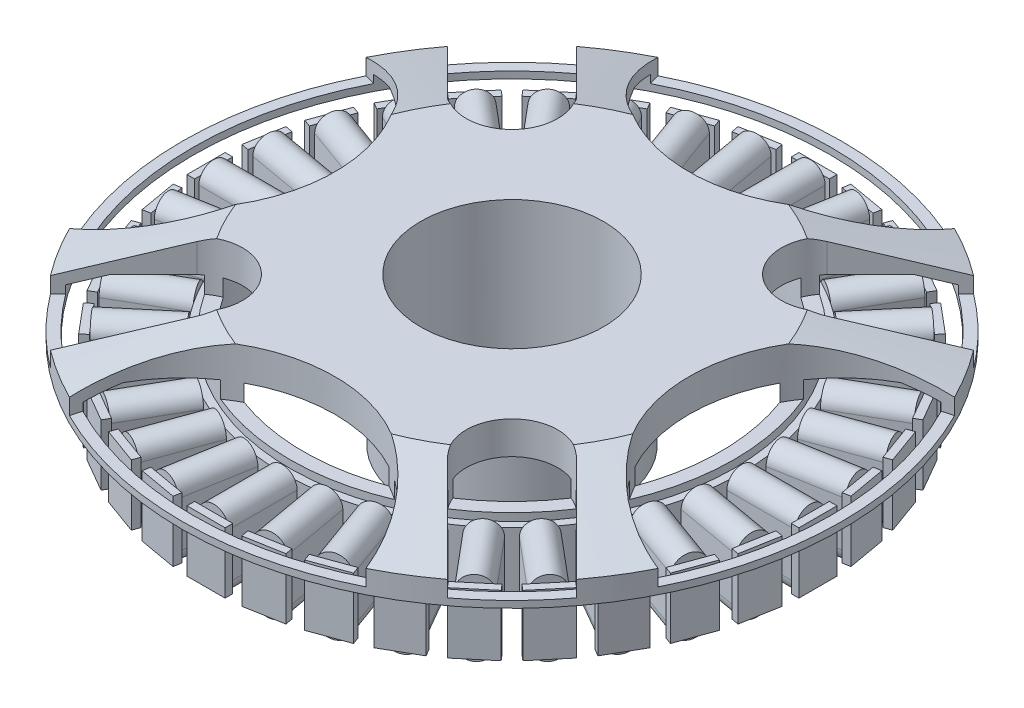
from build123d import *
from build123d.topology import SkipClean

# Parameters (mm, degrees)
SKETCH1_R           = 43.25
SKETCH1_R_2         = 41.85
BOSS_EXTRUDE1_DEPTH = 1.5
SKETCH3_R           = 13.5
BOSS_EXTRUDE2_DEPTH = 15
SKETCH4_R           = 7.5
BOSS_EXTRUDE3_DEPTH = 18
SKETCH5_R           = 6.6
CUT_EXTRUDE1_DEPTH  = 20
SKETCH6_R           = 2.5
CUT_EXTRUDE2_DEPTH  = 72.640875204
SKETCH7_R           = 20
CUT_EXTRUDE3_DEPTH  = 6.5
SKETCH8_R           = 12
CUT_EXTRUDE4_DEPTH  = 72.640875204
SKETCH10_R          = 29.15
SKETCH10_R_2        = 27.35
BOSS_EXTRUDE4_DEPTH = 10
BOSS_EXTRUDE5_START = 2.2
BOSS_EXTRUDE5_DEPTH = 2.2
BOSS_EXTRUDE6_START = -8
BOSS_EXTRUDE6_DEPTH = 8
BOSS_EXTRUDE7_DEPTH = 9
CIRPATTERN1_COUNT   = 36
BOSS_EXTRUDE8_START = -8
SKETCH14_R          = 30.15
SKETCH14_R_2        = 29.15
BOSS_EXTRUDE8_DEPTH = 8
CIRPATTERN2_COUNT   = 36


with BuildPart() as part:
    # Sketch1 → Boss-Extrude1 (new body)
    with BuildSketch(Plane(origin=(0, 0, 0), x_dir=(1, 0, 0), z_dir=(0, 1, 0))):
        with Locations(Location((0, 0, 0), (0, 0, 270))):
            Circle(SKETCH1_R)
        with Locations(Location((0, 0, 0), (0, 0, 270))):
            Circle(SKETCH1_R_2, mode=Mode.SUBTRACT)
    extrude(amount=BOSS_EXTRUDE1_DEPTH)

    # Sketch2 → Revolve1 (revolve)
    with BuildSketch(Plane.XY):
        Polygon((0, 7.4), (-28, 7.4), (-43.25, 3), (-43.25, 1.5), (-41.85, 1.5), (-41.85, 1.946826667), (-37.853206063, 3.1), (0, 3.1), align=None)
    revolve(axis=Axis((0, 7.4, 0), (0, -1, 0)))

    # Sketch3 → Boss-Extrude2 (add)
    with BuildSketch(Plane.XZ.offset(-3.1)):
        Circle(SKETCH3_R)
    extrude(amount=BOSS_EXTRUDE2_DEPTH)

    # Sketch4 → Boss-Extrude3 (add)
    with BuildSketch(Plane.XZ.offset(11.9)):
        Circle(SKETCH4_R)
    extrude(amount=BOSS_EXTRUDE3_DEPTH)

    # Sketch5 → Cut-Extrude1 (cut)
    with BuildSketch(Plane(origin=(0, 7.4, 0), x_dir=(1, 0, 0), z_dir=(0, 1, 0))):
        with Locations(Location((0, 0, 0), (0, 0, 180))):
            Circle(SKETCH5_R)
    extrude(amount=-CUT_EXTRUDE1_DEPTH, mode=Mode.SUBTRACT)

    # Sketch6 → Cut-Extrude2 (cut, through all)
    with BuildSketch(Plane.XZ.offset(29.9)):
        Circle(SKETCH6_R)
    extrude(amount=-CUT_EXTRUDE2_DEPTH, mode=Mode.SUBTRACT)

    # Sketch7 → Cut-Extrude3 (cut)
    with SkipClean():  # the faces are left unmerged after this step: merging them gives an invalid solid
        with BuildSketch(Plane(origin=(0, 7.4, 0), x_dir=(1, 0, 0), z_dir=(0, 1, 0))):
            with Locations((0, 43.25)):
                Circle(SKETCH7_R)
            with Locations((43.25, 0)):
                Circle(SKETCH7_R)
            with Locations((0, -43.25)):
                Circle(SKETCH7_R)
            with Locations((-43.25, 0)):
                Circle(SKETCH7_R)
            with BuildLine():
                Line((-26.339727599, 34.825008973), (-16.440232663, 24.925514037))
                ThreePointArc((-16.440232663, 24.925514037), (-16.440232663, 16.440232663), (-24.925514037, 16.440232663))
                Line((-24.925514037, 16.440232663), (-34.825008973, 26.339727599))
                ThreePointArc((-34.825008973, 26.339727599), (-34.825008973, 34.825008973), (-26.339727599, 34.825008973))
            make_face()
            with BuildLine():
                Line((26.339727599, 34.825008973), (16.440232663, 24.925514037))
                ThreePointArc((16.440232663, 24.925514037), (16.440232663, 16.440232663), (24.925514037, 16.440232663))
                Line((24.925514037, 16.440232663), (34.825008973, 26.339727599))
                ThreePointArc((34.825008973, 26.339727599), (34.825008973, 34.825008973), (26.339727599, 34.825008973))
            make_face()
            with BuildLine():
                Line((34.825008973, -26.339727599), (24.925514037, -16.440232663))
                ThreePointArc((24.925514037, -16.440232663), (16.440232663, -16.440232663), (16.440232663, -24.925514037))
                Line((16.440232663, -24.925514037), (26.339727599, -34.825008973))
                ThreePointArc((26.339727599, -34.825008973), (34.825008973, -34.825008973), (34.825008973, -26.339727599))
            make_face()
            with BuildLine():
                Line((-26.339727599, -34.825008973), (-16.440232663, -24.925514037))
                ThreePointArc((-16.440232663, -24.925514037), (-16.440232663, -16.440232663), (-24.925514037, -16.440232663))
                Line((-24.925514037, -16.440232663), (-34.825008973, -26.339727599))
                ThreePointArc((-34.825008973, -26.339727599), (-34.825008973, -34.825008973), (-26.339727599, -34.825008973))
            make_face()
        extrude(amount=-CUT_EXTRUDE3_DEPTH, mode=Mode.SUBTRACT)

    # Sketch8 → Cut-Extrude4 (cut, through all)
    with SkipClean():  # the faces are left unmerged after this step: merging them gives an invalid solid
        with BuildSketch(Plane(origin=(0, 7.4, 0), x_dir=(1, 0, 0), z_dir=(0, 1, 0))):
            with Locations(Location((0, 0, 0), (0, 0, 180))):
                Circle(SKETCH8_R)
        extrude(amount=-CUT_EXTRUDE4_DEPTH, mode=Mode.SUBTRACT)



with BuildPart() as body_2:
    # Sketch10 → Boss-Extrude4 (new body)
    with BuildSketch(Plane(origin=(0, 0.9, 0), x_dir=(1, 0, 0), z_dir=(0, 1, 0))):
        with Locations(Location((0, 0, 0), (0, 0, 180))):
            Circle(SKETCH10_R)
        with Locations(Location((0, 0, 0), (0, 0, 180))):
            Circle(SKETCH10_R_2, mode=Mode.SUBTRACT)
    extrude(amount=-BOSS_EXTRUDE4_DEPTH)


with BuildPart() as part_1:
    with SkipClean():  # the faces are left unmerged after this step: merging them gives an invalid solid
        add(part.part)

        add(body_2.part)  # Boss-Extrude5 merges body 2
        # Sketch11 → Boss-Extrude5 (add)
        with BuildSketch(Plane(origin=(0, 0.9, 0), x_dir=(1, 0, 0), z_dir=(0, 1, 0)).offset(BOSS_EXTRUDE5_START)):
            with BuildLine():
                ThreePointArc((24.389531526, -15.964750294), (25.707885383, -13.741438395), (26.824104046, -11.410080723))
                ThreePointArc((26.824104046, -11.410080723), (26.209360129, -10.469794305), (25.648381503, -9.496474413))
                ThreePointArc((25.648381503, -9.496474413), (24.394010533, -12.367487624), (22.819521394, -15.076204541))
                ThreePointArc((22.819521394, -15.076204541), (23.638111967, -15.461133724), (24.389531526, -15.964750294))
            make_face()
            with BuildLine():
                ThreePointArc((11.410080723, -26.824104046), (13.741438395, -25.707885383), (15.964750294, -24.389531526))
                ThreePointArc((15.964750294, -24.389531526), (15.461133724, -23.638111967), (15.076204541, -22.819521394))
                ThreePointArc((15.076204541, -22.819521394), (12.367487624, -24.394010533), (9.496474413, -25.648381503))
                ThreePointArc((9.496474413, -25.648381503), (10.469794305, -26.209360129), (11.410080723, -26.824104046))
            make_face()
            with BuildLine():
                ThreePointArc((-15.964750294, -24.389531526), (-13.741438395, -25.707885383), (-11.410080723, -26.824104046))
                ThreePointArc((-11.410080723, -26.824104046), (-10.469794305, -26.209360129), (-9.496474413, -25.648381503))
                ThreePointArc((-9.496474413, -25.648381503), (-12.367487624, -24.394010533), (-15.076204541, -22.819521394))
                ThreePointArc((-15.076204541, -22.819521394), (-15.461133724, -23.638111967), (-15.964750294, -24.389531526))
            make_face()
            with BuildLine():
                ThreePointArc((26.824104046, 11.410080723), (25.707885383, 13.741438395), (24.389531526, 15.964750294))
                ThreePointArc((24.389531526, 15.964750294), (23.638111967, 15.461133724), (22.819521394, 15.076204541))
                ThreePointArc((22.819521394, 15.076204541), (24.394010533, 12.367487624), (25.648381503, 9.496474413))
                ThreePointArc((25.648381503, 9.496474413), (26.209360129, 10.469794305), (26.824104046, 11.410080723))
            make_face()
            with BuildLine():
                ThreePointArc((-26.824104046, -11.410080723), (-25.707885383, -13.741438395), (-24.389531526, -15.964750294))
                ThreePointArc((-24.389531526, -15.964750294), (-23.638111967, -15.461133724), (-22.819521394, -15.076204541))
                ThreePointArc((-22.819521394, -15.076204541), (-24.394010533, -12.367487624), (-25.648381503, -9.496474413))
                ThreePointArc((-25.648381503, -9.496474413), (-26.209360129, -10.469794305), (-26.824104046, -11.410080723))
            make_face()
            with BuildLine():
                ThreePointArc((15.964750294, 24.389531526), (13.741438395, 25.707885383), (11.410080723, 26.824104046))
                ThreePointArc((11.410080723, 26.824104046), (10.469794305, 26.209360129), (9.496474413, 25.648381503))
                ThreePointArc((9.496474413, 25.648381503), (12.367487624, 24.394010533), (15.076204541, 22.819521394))
                ThreePointArc((15.076204541, 22.819521394), (15.461133724, 23.638111967), (15.964750294, 24.389531526))
            make_face()
            with BuildLine():
                ThreePointArc((-24.389531526, 15.964750294), (-25.707885383, 13.741438395), (-26.824104046, 11.410080723))
                ThreePointArc((-26.824104046, 11.410080723), (-26.209360129, 10.469794305), (-25.648381503, 9.496474413))
                ThreePointArc((-25.648381503, 9.496474413), (-24.394010533, 12.367487624), (-22.819521394, 15.076204541))
                ThreePointArc((-22.819521394, 15.076204541), (-23.638111967, 15.461133724), (-24.389531526, 15.964750294))
            make_face()
            with BuildLine():
                ThreePointArc((-11.410080723, 26.824104046), (-13.741438395, 25.707885383), (-15.964750294, 24.389531526))
                ThreePointArc((-15.964750294, 24.389531526), (-15.461133724, 23.638111967), (-15.076204541, 22.819521394))
                ThreePointArc((-15.076204541, 22.819521394), (-12.367487624, 24.394010533), (-9.496474413, 25.648381503))
                ThreePointArc((-9.496474413, 25.648381503), (-10.469794305, 26.209360129), (-11.410080723, 26.824104046))
            make_face()
        extrude(amount=-BOSS_EXTRUDE5_DEPTH)

    # Sketch12 → Boss-Extrude6 (add)
    with SkipClean():  # the faces are left unmerged after this step: merging them gives an invalid solid
        with BuildSketch(Plane(origin=(0, -8.1, 0), x_dir=(-1, 0, 0), z_dir=(0, -1, 0)).offset(BOSS_EXTRUDE6_START)):
            with BuildLine():
                Line((-2.5, 40.15), (2.5, 40.15))
                Line((2.5, 40.15), (2.5, 39.15))
                Line((2.5, 39.15), (0.5, 39.15))
                Line((0.5, 39.15), (0.5, 29.14571152))
                ThreePointArc((0.5, 29.14571152), (0, 29.15), (-0.5, 29.14571152))
                Line((-0.5, 29.14571152), (-0.5, 39.15))
                Line((-0.5, 39.15), (-2.5, 39.15))
                Line((-2.5, 39.15), (-2.5, 40.15))
            make_face()
        boss_extrude6 = extrude(amount=BOSS_EXTRUDE6_DEPTH)

    # Sketch13 → Boss-Extrude7 (add)
    with SkipClean():  # the faces are left unmerged after this step: merging them gives an invalid solid
        with BuildSketch(Plane.XY.offset(-39.15)):
            with BuildLine():
                Line((1.95, -1.1), (1.95, -7.1))
                ThreePointArc((1.95, -7.1), (0, -9.05), (-1.95, -7.1))
                Line((-1.95, -7.1), (-1.95, -1.1))
                ThreePointArc((-1.95, -1.1), (0, 0.85), (1.95, -1.1))
            make_face()
        boss_extrude7 = extrude(amount=BOSS_EXTRUDE7_DEPTH)

    # CirPattern1: Boss-Extrude6 ×36 about axis
    with SkipClean():  # the faces are left unmerged after this step: merging them gives an invalid solid
        cirpattern1_axis = Axis((0, 0, 0), (0, 1, 0))
        for i in range(1, CIRPATTERN1_COUNT):
            add(boss_extrude6.rotate(cirpattern1_axis, i * 360 / CIRPATTERN1_COUNT))

    # Sketch14 → Boss-Extrude8 (add)
    with SkipClean():  # the faces are left unmerged after this step: merging them gives an invalid solid
        with BuildSketch(Plane.XZ.offset(8.1).offset(BOSS_EXTRUDE8_START)):
            Circle(SKETCH14_R)
            Circle(SKETCH14_R_2, mode=Mode.SUBTRACT)
        extrude(amount=BOSS_EXTRUDE8_DEPTH)

    # CirPattern2: Boss-Extrude7 ×36 about axis
    with SkipClean():  # the faces are left unmerged after this step: merging them gives an invalid solid
        cirpattern2_axis = Axis((0, 0, 0), (0, 1, 0))
        for i in range(1, CIRPATTERN2_COUNT):
            add(boss_extrude7.rotate(cirpattern2_axis, i * 360 / CIRPATTERN2_COUNT))


solid = part_1.part
